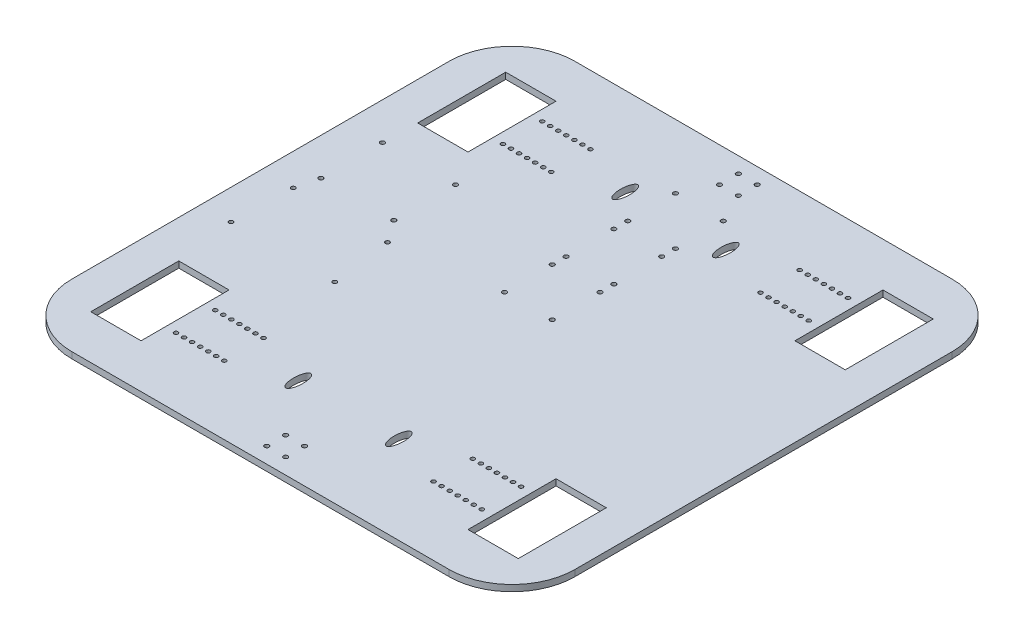
from build123d import *

# Parameters (mm, degrees)
SKETCH1_W           = 400
SKETCH1_H           = 400
SKETCH1_R           = 1.75
SKETCH1_W_2         = 40
SKETCH1_H_2         = 70
BOSS_EXTRUDE2_DEPTH = 5
FILLET1_R           = 50
SKETCH2_R           = 1.6
CUT_EXTRUDE1_DEPTH  = 5
SKETCH3_R           = 1.65
CUT_EXTRUDE2_DEPTH  = 10
SKETCH4_R           = 1.75
CUT_EXTRUDE3_DEPTH  = 10
SKETCH5_R           = 1.75
CUT_EXTRUDE4_DEPTH  = 10
SKETCH6_RX          = 10
SKETCH6_RY          = 3.75
CUT_EXTRUDE5_DEPTH  = 10


with BuildPart() as part:
    # Sketch1 → Boss-Extrude2 (new body)
    with BuildSketch(Plane(origin=(0, 0, 0), x_dir=(1, 0, 0), z_dir=(0, 1, 0))):
        Rectangle(SKETCH1_W, SKETCH1_H)
        with Locations((-7.5, 172.5)):
            Circle(SKETCH1_R, mode=Mode.SUBTRACT)
        with Locations((-7.5, 187.5)):
            Circle(SKETCH1_R, mode=Mode.SUBTRACT)
        with Locations((7.5, 172.5)):
            Circle(SKETCH1_R, mode=Mode.SUBTRACT)
        with Locations((7.5, 187.5)):
            Circle(SKETCH1_R, mode=Mode.SUBTRACT)
        with Locations((-150, -130)):
            Rectangle(SKETCH1_W_2, SKETCH1_H_2, mode=Mode.SUBTRACT)
        with Locations((150, -130)):
            Rectangle(SKETCH1_W_2, SKETCH1_H_2, mode=Mode.SUBTRACT)
        with Locations((-150, 130)):
            Rectangle(SKETCH1_W_2, SKETCH1_H_2, mode=Mode.SUBTRACT)
        with Locations((150, 130)):
            Rectangle(SKETCH1_W_2, SKETCH1_H_2, mode=Mode.SUBTRACT)
        with Locations((-7.5, -187.5)):
            Circle(SKETCH1_R, mode=Mode.SUBTRACT)
        with Locations((-7.5, -172.5)):
            Circle(SKETCH1_R, mode=Mode.SUBTRACT)
        with Locations((7.5, -187.5)):
            Circle(SKETCH1_R, mode=Mode.SUBTRACT)
        with Locations((7.5, -172.5)):
            Circle(SKETCH1_R, mode=Mode.SUBTRACT)
    extrude(amount=BOSS_EXTRUDE2_DEPTH)

    # Fillet1
    fillet1_edges = [part.edges().sort_by_distance(p)[0] for p in [
        (200, 2.5, -200),
        (200, 2.5, 200),
        (-200, 2.5, 200),
        (-200, 2.5, -200),
    ]]
    fillet(fillet1_edges, radius=FILLET1_R)

    # Sketch2 → Cut-Extrude1 (cut)
    with BuildSketch(Plane(origin=(0, 5, 0), x_dir=(1, 0, 0), z_dir=(0, 1, 0))):
        with Locations((-121.6, 145.6)):
            Circle(SKETCH2_R)
        with Locations((-115.2, 145.6)):
            Circle(SKETCH2_R)
        with Locations((-108.8, 145.6)):
            Circle(SKETCH2_R)
        with Locations((-102.4, 145.6)):
            Circle(SKETCH2_R)
        with Locations((-96, 145.6)):
            Circle(SKETCH2_R)
        with Locations((-89.6, 145.6)):
            Circle(SKETCH2_R)
        with Locations((-83.2, 145.6)):
            Circle(SKETCH2_R)
        with Locations((-83.2, 114.4)):
            Circle(SKETCH2_R)
        with Locations((-89.6, 114.4)):
            Circle(SKETCH2_R)
        with Locations((-96, 114.4)):
            Circle(SKETCH2_R)
        with Locations((-102.4, 114.4)):
            Circle(SKETCH2_R)
        with Locations((-108.8, 114.4)):
            Circle(SKETCH2_R)
        with Locations((-115.2, 114.4)):
            Circle(SKETCH2_R)
        with Locations((-121.6, 114.4)):
            Circle(SKETCH2_R)
        with Locations((83.2, 114.4)):
            Circle(SKETCH2_R)
        with Locations((89.6, 114.4)):
            Circle(SKETCH2_R)
        with Locations((96, 114.4)):
            Circle(SKETCH2_R)
        with Locations((102.4, 114.4)):
            Circle(SKETCH2_R)
        with Locations((108.8, 114.4)):
            Circle(SKETCH2_R)
        with Locations((115.2, 114.4)):
            Circle(SKETCH2_R)
        with Locations((121.6, 114.4)):
            Circle(SKETCH2_R)
        with Locations((83.2, 145.6)):
            Circle(SKETCH2_R)
        with Locations((89.6, 145.6)):
            Circle(SKETCH2_R)
        with Locations((96, 145.6)):
            Circle(SKETCH2_R)
        with Locations((102.4, 145.6)):
            Circle(SKETCH2_R)
        with Locations((108.8, 145.6)):
            Circle(SKETCH2_R)
        with Locations((115.2, 145.6)):
            Circle(SKETCH2_R)
        with Locations((121.6, 145.6)):
            Circle(SKETCH2_R)
        with Locations((121.6, -145.6)):
            Circle(SKETCH2_R)
        with Locations((115.2, -145.6)):
            Circle(SKETCH2_R)
        with Locations((108.8, -145.6)):
            Circle(SKETCH2_R)
        with Locations((102.4, -145.6)):
            Circle(SKETCH2_R)
        with Locations((96, -145.6)):
            Circle(SKETCH2_R)
        with Locations((89.6, -145.6)):
            Circle(SKETCH2_R)
        with Locations((83.2, -145.6)):
            Circle(SKETCH2_R)
        with Locations((121.6, -114.4)):
            Circle(SKETCH2_R)
        with Locations((115.2, -114.4)):
            Circle(SKETCH2_R)
        with Locations((108.8, -114.4)):
            Circle(SKETCH2_R)
        with Locations((102.4, -114.4)):
            Circle(SKETCH2_R)
        with Locations((96, -114.4)):
            Circle(SKETCH2_R)
        with Locations((89.6, -114.4)):
            Circle(SKETCH2_R)
        with Locations((83.2, -114.4)):
            Circle(SKETCH2_R)
        with Locations((-121.6, -114.4)):
            Circle(SKETCH2_R)
        with Locations((-115.2, -114.4)):
            Circle(SKETCH2_R)
        with Locations((-108.8, -114.4)):
            Circle(SKETCH2_R)
        with Locations((-102.4, -114.4)):
            Circle(SKETCH2_R)
        with Locations((-96, -114.4)):
            Circle(SKETCH2_R)
        with Locations((-89.6, -114.4)):
            Circle(SKETCH2_R)
        with Locations((-83.2, -114.4)):
            Circle(SKETCH2_R)
        with Locations((-83.2, -145.6)):
            Circle(SKETCH2_R)
        with Locations((-89.6, -145.6)):
            Circle(SKETCH2_R)
        with Locations((-96, -145.6)):
            Circle(SKETCH2_R)
        with Locations((-102.4, -145.6)):
            Circle(SKETCH2_R)
        with Locations((-108.8, -145.6)):
            Circle(SKETCH2_R)
        with Locations((-115.2, -145.6)):
            Circle(SKETCH2_R)
        with Locations((-121.6, -145.6)):
            Circle(SKETCH2_R)
    extrude(amount=-CUT_EXTRUDE1_DEPTH, mode=Mode.SUBTRACT)

    # Sketch3 → Cut-Extrude2 (cut)
    with BuildSketch(Plane(origin=(0, 5, 0), x_dir=(1, 0, 0), z_dir=(0, 1, 0))):
        with Locations((-176.03, -47.46)):
            Circle(SKETCH3_R)
        with Locations((-174.76, 0.8)):
            Circle(SKETCH3_R)
        with Locations((-93.48, -47.46)):
            Circle(SKETCH3_R)
        with Locations((-99.83, 0.8)):
            Circle(SKETCH3_R)
    extrude(amount=-CUT_EXTRUDE2_DEPTH, mode=Mode.SUBTRACT)

    # Sketch4 → Cut-Extrude3 (cut)
    with BuildSketch(Plane(origin=(0, 5, 0), x_dir=(1, 0, 0), z_dir=(0, 1, 0))):
        with Locations((-19, 149)):
            Circle(SKETCH4_R)
        with Locations((19, 149)):
            Circle(SKETCH4_R)
        with Locations((19, 111)):
            Circle(SKETCH4_R)
        with Locations((-19, 111)):
            Circle(SKETCH4_R)
        with Locations((-19, 100)):
            Circle(SKETCH4_R)
        with Locations((19, 100)):
            Circle(SKETCH4_R)
        with Locations((19, 62)):
            Circle(SKETCH4_R)
        with Locations((-19, 62)):
            Circle(SKETCH4_R)
        with Locations((-19, 13)):
            Circle(SKETCH4_R)
        with Locations((19, 13)):
            Circle(SKETCH4_R)
        with Locations((-19, 51)):
            Circle(SKETCH4_R)
        with Locations((19, 51)):
            Circle(SKETCH4_R)
    extrude(amount=-CUT_EXTRUDE3_DEPTH, mode=Mode.SUBTRACT)

    # Sketch5 → Cut-Extrude4 (cut)
    with BuildSketch(Plane(origin=(0, 5, 0), x_dir=(1, 0, 0), z_dir=(0, 1, 0))):
        with Locations((-170.5, 67.5)):
            Circle(SKETCH5_R)
        with Locations((-112.5, 67.5)):
            Circle(SKETCH5_R)
        with Locations((-112.5, 18.5)):
            Circle(SKETCH5_R)
        with Locations((-170.5, 18.5)):
            Circle(SKETCH5_R)
    extrude(amount=-CUT_EXTRUDE4_DEPTH, mode=Mode.SUBTRACT)

    # Sketch6 → Cut-Extrude5 (cut)
    with BuildSketch(Plane(origin=(0, 5, 0), x_dir=(1, 0, 0), z_dir=(0, 1, 0))):
        with Locations(Location((-40, 130), (0, 0, 90))):
            Ellipse(SKETCH6_RX, SKETCH6_RY)
        with Locations(Location((40, 130), (0, 0, 90))):
            Ellipse(SKETCH6_RX, SKETCH6_RY)
        with Locations(Location((40, -130), (0, 0, -90))):
            Ellipse(SKETCH6_RX, SKETCH6_RY)
        with Locations(Location((-40, -130), (0, 0, -90))):
            Ellipse(SKETCH6_RX, SKETCH6_RY)
    extrude(amount=-CUT_EXTRUDE5_DEPTH, mode=Mode.SUBTRACT)


solid = part.part
